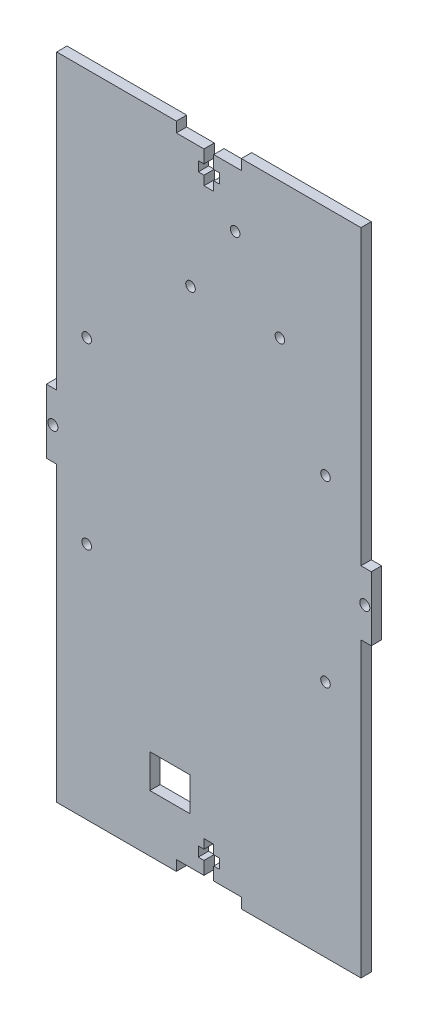
from build123d import *

# Parameters (mm, degrees)
SKETCH1_W           = 100
SKETCH1_H           = 200
BOSS_EXTRUDE2_DEPTH = 3.18
SKETCH2_R           = 1.55
SKETCH2_W           = 3.18
SKETCH2_H           = 90.125
CUT_EXTRUDE1_DEPTH  = 112.84861376
SKETCH4_W           = 12.353553391
SKETCH4_H           = 10.353553391
CUT_EXTRUDE3_DEPTH  = 112.84861376
SKETCH5_R           = 1.47
CUT_EXTRUDE4_DEPTH  = 112.84861376
SKETCH6_R           = 1.47
CUT_EXTRUDE5_DEPTH  = 112.84861376


with BuildPart() as part:
    # Sketch1 → Boss-Extrude2 (new body)
    with BuildSketch(Plane.XY):
        Rectangle(SKETCH1_W, SKETCH1_H)
    extrude(amount=BOSS_EXTRUDE2_DEPTH)

    # Sketch2 → Cut-Extrude1 (cut, through all)
    with BuildSketch(Plane.XY.offset(3.18)):
        with Locations((-48, 0)):
            Circle(SKETCH2_R)
        Polygon((-10, 100), (-10, 96.82), (-1.5, 96.82), (-1.5, 92.82), (-3.25, 92.82), (-3.25, 89.82), (-1.5, 89.82), (-1.5, 87), (1.5, 87), (1.5, 89.82), (3.25, 89.82), (3.25, 92.82), (1.5, 92.82), (1.5, 96.82), (10, 96.82), (10, 100), align=None)
        with Locations((-48.41, 54.9375)):
            Rectangle(SKETCH2_W, SKETCH2_H)
        with Locations((-48.41, -54.9375)):
            Rectangle(SKETCH2_W, SKETCH2_H)
    cut_extrude1 = extrude(amount=-CUT_EXTRUDE1_DEPTH, mode=Mode.SUBTRACT)

    # Mirror1: Cut-Extrude1 across plane
    add(cut_extrude1.mirror(Plane.ZX), mode=Mode.SUBTRACT)

    # Mirror3: Cut-Extrude1 across plane
    add(cut_extrude1.mirror(Plane(origin=(0, 0, 0), x_dir=(0, 0, 1), z_dir=(1, 0, 0))), mode=Mode.SUBTRACT)

    # Sketch4 → Cut-Extrude3 (cut, through all)
    with BuildSketch(Plane.XY.offset(3.18)):
        with Locations((-11.973223305, -77.343223305)):
            Rectangle(SKETCH4_W, SKETCH4_H)
    extrude(amount=-CUT_EXTRUDE3_DEPTH, mode=Mode.SUBTRACT)

    # Sketch5 → Cut-Extrude4 (cut, through all)
    with BuildSketch(Plane.XY.offset(3.18)):
        with Locations((-37.58090562, 28.464149283)):
            Circle(SKETCH5_R)
        with Locations((35.904481485, 28.464149283)):
            Circle(SKETCH5_R)
        with Locations((-37.58090562, -26.535850717)):
            Circle(SKETCH5_R)
        with Locations((35.904481485, -26.535850717)):
            Circle(SKETCH5_R)
    extrude(amount=-CUT_EXTRUDE4_DEPTH, mode=Mode.SUBTRACT)

    # Sketch6 → Cut-Extrude5 (cut, through all)
    with BuildSketch(Plane.XY.offset(3.18)):
        with Locations((-5.638260743, 58.12)):
            Circle(SKETCH6_R)
        with Locations((8.111739257, 79.62)):
            Circle(SKETCH6_R)
        with Locations((21.861739257, 58.12)):
            Circle(SKETCH6_R)
    extrude(amount=-CUT_EXTRUDE5_DEPTH, mode=Mode.SUBTRACT)


solid = part.part
